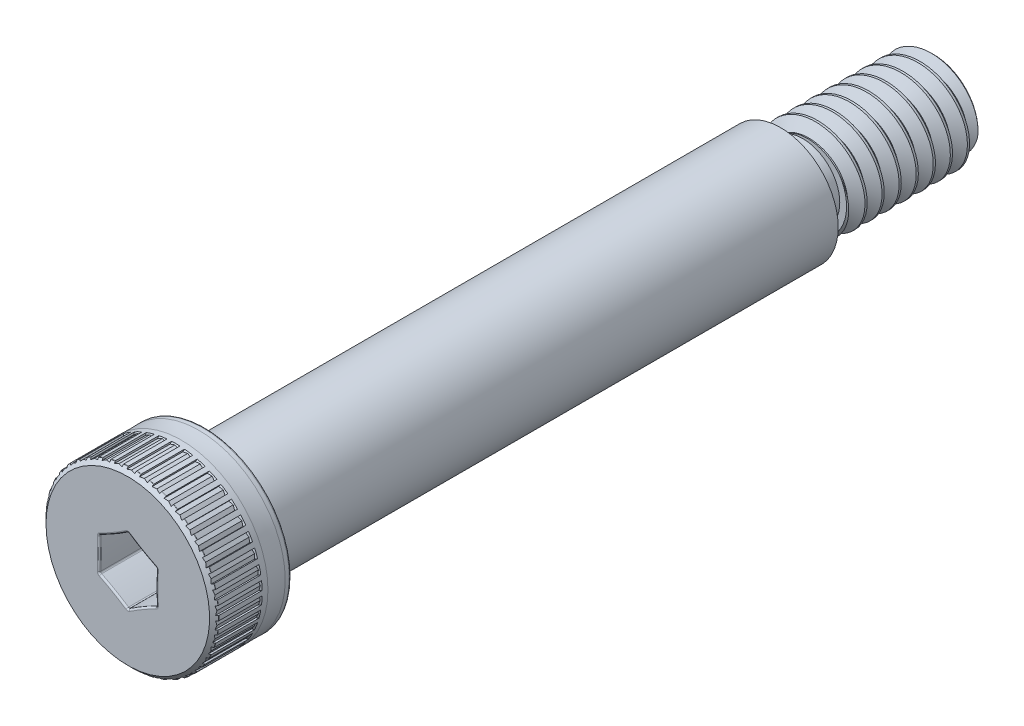
from build123d import *

# Parameters (mm, degrees)
SKETCH4_W             = 1.5875
SKETCH4_H             = 0.47625
SKETCH4_W_2           = 1.834444444
SKETCH4_H_2           = 0.916543552
CHAMFER1_SIZE         = 0.47625
FILLET1_R             = 0.28575
FILLET2_R             = 0.282222222
CHAMFER2_SIZE         = 0.352777778
CHAMFER3_SIZE         = 0.381
CUT_EXTRUDE1_DEPTH    = 3.9751
FILLET4_R             = 0.142875
DELETEFACE1_START     = -49.459444444
DELETEFACE1_OUTLINE_W = 10
DELETEFACE1_OUTLINE_H = 10
DELETEFACE1_OUTLINE_R = 3.058556448
DELETEFACE1_DEPTH     = 0.282222322
CUT_SWEEP1_PITCH      = 1.411111111
CUT_EXTRUDE2_REACH    = 69.436
CIRPATTERN1_COUNT     = 42
FILLET5_R             = 0.0508


# Read off the part's stored shape, not the designer's step: DeleteFace1, CirPattern2
with BuildPart() as part:
    # Sketch3 → Revolve1 (revolve)
    with BuildSketch(Plane(origin=(0, 0, 0), x_dir=(0, 0, -1), z_dir=(1, 0, 0)), mode=Mode.PRIVATE) as revolve1_sk:
        Polygon((-6.35, 7.14375), (0, 7.14375), (0, 4.7625), (47.625, 4.7625), (47.625, 3.9751), (60.325, 3.9751), (60.325, 0), (-6.35, 0), align=None)
    revolve(revolve1_sk.sketch.rotate(Axis((0, 0, 6.35), (0, 0, -1)), 90), axis=Axis((0, 0, 6.35), (0, 0, -1)))

    # Sketch4 → Cut-Revolve1 (revolve, cut)
    with BuildSketch(Plane(origin=(0, 0, 0), x_dir=(0, 0, -1), z_dir=(1, 0, 0)), mode=Mode.PRIVATE) as cut_revolve1_sk:
        with Locations((0.79375, 4.524375)):
            Rectangle(SKETCH4_W, SKETCH4_H)
        with Locations((48.542222222, 3.516828224)):
            Rectangle(SKETCH4_W_2, SKETCH4_H_2)
    revolve(cut_revolve1_sk.sketch.rotate(Axis((0, 0, 6.35), (0, 0, -1)), 90), axis=Axis((0, 0, 6.35), (0, 0, -1)), mode=Mode.SUBTRACT)

    # Chamfer1
    chamfer1_edges = [part.edges().sort_by_distance(p)[0] for p in [
        (-4.28625, 0, -1.5875),
    ]]
    chamfer(chamfer1_edges, length=CHAMFER1_SIZE - 0.0001)  # a hair under: the kernel refuses the full size

    # Fillet1
    fillet1_edges = [part.edges().sort_by_distance(p)[0] for p in [
        (-4.28625, 0, 0),
    ]]
    fillet(fillet1_edges, radius=FILLET1_R)

    # Fillet2
    fillet2_edges = [part.edges().sort_by_distance(p)[0] for p in [
        (-3.058556448, 0, -47.625),
        (-3.058556448, 0, -49.459444444),
    ]]
    fillet(fillet2_edges, radius=FILLET2_R)

    # Chamfer2
    chamfer2_edges = [part.edges().sort_by_distance(p)[0] for p in [
        (-3.9751, 0, -49.459444444),
        (-3.9751, 0, -60.325),
    ]]
    chamfer(chamfer2_edges, length=CHAMFER2_SIZE)

    # Chamfer3
    chamfer3_edges = [part.edges().sort_by_distance(p)[0] for p in [
        (-7.14375, 0, 6.35),
    ]]
    chamfer(chamfer3_edges, length=CHAMFER3_SIZE)

    # Sketch5 → Cut-Extrude1 (cut)
    with BuildSketch(Plane.XY.offset(6.35)):
        with BuildLine():
            ThreePointArc((2.38125, 1.374815329), (1.1668125, 2.020978533), (0, 2.749630657))
            ThreePointArc((0, 2.749630657), (-1.1668125, 2.020978533), (-2.38125, 1.374815329))
            ThreePointArc((-2.38125, 1.374815329), (-2.333625, 0), (-2.38125, -1.374815329))
            ThreePointArc((-2.38125, -1.374815329), (-1.1668125, -2.020978533), (0, -2.749630657))
            ThreePointArc((0, -2.749630657), (1.1668125, -2.020978533), (2.38125, -1.374815329))
            ThreePointArc((2.38125, -1.374815329), (2.333625, 0), (2.38125, 1.374815329))
        make_face()
    extrude(amount=-CUT_EXTRUDE1_DEPTH, mode=Mode.SUBTRACT)

    # Fillet4
    fillet4_edges = [part.edges().sort_by_distance(p)[0] for p in [
        (2.333625, 0, 2.3749),
        (2.38125, 1.374815329, 4.36245),
        (1.1668125, -2.020978533, 2.3749),
        (2.38125, -1.374815329, 4.36245),
        (-1.1668125, -2.020978533, 2.3749),
        (0, -2.749630657, 4.36245),
        (-2.333625, 0, 2.3749),
        (-2.38125, -1.374815329, 4.36245),
        (-1.1668125, 2.020978533, 2.3749),
        (-2.38125, 1.374815329, 4.36245),
        (1.1668125, 2.020978533, 2.3749),
        (0, 2.749630657, 4.36245),
        (2.333625, 0, 6.35),
        (1.1668125, 2.020978533, 6.35),
        (-1.1668125, 2.020978533, 6.35),
        (-2.333625, 0, 6.35),
        (-1.1668125, -2.020978533, 6.35),
        (1.1668125, -2.020978533, 6.35),
        (-7.14375, 0, 0),
    ]]
    fillet(fillet4_edges, radius=FILLET4_R)

    # DeleteFace1 outline → DeleteFace1 (cut)
    with BuildSketch(Plane.XY.offset(DELETEFACE1_START)):
        Rectangle(DELETEFACE1_OUTLINE_W, DELETEFACE1_OUTLINE_H)
        Circle(DELETEFACE1_OUTLINE_R, mode=Mode.SUBTRACT)
    extrude(amount=DELETEFACE1_DEPTH, mode=Mode.SUBTRACT)

    # Cut-Sweep1: the profile of Sketch7 profile screwed along a right-hand helix of 8.48 turns, 8 arcs to a turn; built about Z, then put on its axis
    cut_sweep1_z = Axis((0, 0, 0), (0, 0, 1))
    cut_sweep1_corners = [(4.051478629, 0, 0.044097222), (4.051478629, 0, -1.278819444), (3.058256448, 0, -0.70538235), (3.058256448, 0, -0.529339872)]
    with BuildLine(mode=Mode.PRIVATE) as cut_sweep1_profile:
        Line(cut_sweep1_corners[0], cut_sweep1_corners[1])
        Line(cut_sweep1_corners[1], cut_sweep1_corners[2])
        Line(cut_sweep1_corners[2], cut_sweep1_corners[3])
        Line(cut_sweep1_corners[3], cut_sweep1_corners[0])
    cut_sweep1_cap = Face(cut_sweep1_profile.wire())
    cut_sweep1_turn_angles = [0, 22.5, 45, 67.5, 90, 112.5, 135, 157.5, 180, 202.5, 225, 247.5, 270, 292.5, 315, 337.5, 360]
    cut_sweep1_turn_weights = [1, 0.9238795325112867, 1, 0.9238795325112867, 1, 0.9238795325112867, 1, 0.9238795325112867, 1, 0.9238795325112867, 1, 0.9238795325112867, 1, 0.9238795325112867, 1, 0.9238795325112867, 1]
    cut_sweep1_turn_rails = [Edge.make_bspline([Vector(p[0], p[1], 0).rotate(cut_sweep1_z, cut_sweep1_turn_angles[k]) / cut_sweep1_turn_weights[k] + Vector(0, 0, p[2] + CUT_SWEEP1_PITCH * cut_sweep1_turn_angles[k] / 360) for k in range(17)], [0, 0, 0, 1, 1, 2, 2, 3, 3, 4, 4, 5, 5, 6, 6, 7, 7, 8, 8, 8], 2, cut_sweep1_turn_weights) for p in cut_sweep1_corners]
    cut_sweep1_turn_sides = [Face.make_surface_from_curves(cut_sweep1_turn_rails[p[0]], cut_sweep1_turn_rails[p[1]]) for p in [(0, 1), (1, 2), (2, 3), (3, 0)]]
    cut_sweep1_last_angles = [2880, 2902.5, 2925, 2947.5, 2970, 2992.5, 3015, 3033.9, 3052.8]
    cut_sweep1_last_weights = [1, 0.9238795325112867, 1, 0.9238795325112867, 1, 0.9238795325112867, 1, 0.9460853588276014, 1]
    cut_sweep1_last_rails = [Edge.make_bspline([Vector(p[0], p[1], 0).rotate(cut_sweep1_z, cut_sweep1_last_angles[k]) / cut_sweep1_last_weights[k] + Vector(0, 0, p[2] + CUT_SWEEP1_PITCH * cut_sweep1_last_angles[k] / 360) for k in range(9)], [0, 0, 0, 1, 1, 2, 2, 3, 3, 4, 4, 4], 2, cut_sweep1_last_weights) for p in cut_sweep1_corners]
    cut_sweep1_last_sides = [Face.make_surface_from_curves(cut_sweep1_last_rails[p[0]], cut_sweep1_last_rails[p[1]]) for p in [(0, 1), (1, 2), (2, 3), (3, 0)]]
    cut_sweep1 = Plane(origin=(0, 0, -60.325), x_dir=(0, 1, 0), z_dir=(0, 0, 1)) * Solid(Shell([*[p.moved(Location((0, 0, CUT_SWEEP1_PITCH * i))) for i in range(8) for p in cut_sweep1_turn_sides], *cut_sweep1_last_sides, cut_sweep1_cap, cut_sweep1_cap.rotate(cut_sweep1_z, 3052.8).moved(Location((0, 0, CUT_SWEEP1_PITCH * 3052.8 / 360)))]))
    add(cut_sweep1, mode=Mode.SUBTRACT)

    # Cut-Extrude2: up to this plane
    cut_extrude2_end = Plane(origin=(0, 8.546915019, 0.978084981), z_dir=(0, 0.707106781186546, 0.7071067811865491))
    # Sketch8 → Cut-Extrude2 (cut, up to the surface)
    with BuildSketch(Plane.XY.offset(6.35), mode=Mode.PRIVATE) as cut_extrude2_sk1:
        Polygon((-0.3429, 7.14375), (0.3429, 7.14375), (0.328483903, 7.00659), (0, 7.07517), (-0.328483903, 7.00659), align=None)
    cut_extrude2_tool1 = split(extrude(cut_extrude2_sk1.sketch, amount=-CUT_EXTRUDE2_REACH, mode=Mode.PRIVATE), bisect_by=cut_extrude2_end, keep=Keep.BOTH, mode=Mode.PRIVATE)
    cut_extrude2 = cut_extrude2_tool1.solids().sort_by_distance((0, 7.090627, 6.35))[0]
    add(cut_extrude2, mode=Mode.SUBTRACT)

    # CirPattern1: Cut-Extrude2 ×42 about axis
    cirpattern1_axis = Axis((0, 0, 0), (0, 0, 1))
    for i in range(1, CIRPATTERN1_COUNT):
        add(cut_extrude2.rotate(cirpattern1_axis, i * 360 / CIRPATTERN1_COUNT), mode=Mode.SUBTRACT)

    # Fillet5
    fillet5_edges = [part.edges().sort_by_distance(p)[0] for p in [
        (0.533853106, 7.123774626, 5.969),
    ]]
    fillet(fillet5_edges, radius=FILLET5_R)

    # CirPattern2 outline → CirPattern2 (revolve, cut)
    with BuildSketch(Plane.XZ):
        with BuildLine():
            ThreePointArc((7.128871024, 5.983878976), (7.13988308, 5.96739827), (7.14375, 5.947957951))
            Line((7.14375, 5.947957951), (7.14375, 5.983878976))
            Line((7.14375, 5.983878976), (7.128871024, 5.983878976))
        make_face()
    revolve(axis=Axis((0, 0, 0), (0, 0, 1)), mode=Mode.SUBTRACT)

    # Sketch11 → Cut-Revolve6 (revolve, cut)
    with BuildSketch(Plane(origin=(0, 0, 0), x_dir=(0, 0, -1), z_dir=(1, 0, 0)), mode=Mode.PRIVATE) as cut_revolve6_sk:
        with BuildLine():
            Line((-1.905, 7.14375), (-0.47625, 7.14375))
            ThreePointArc((-0.47625, 7.14375), (-1.190625, 7.12597), (-1.905, 7.14375))
        make_face()
    revolve(cut_revolve6_sk.sketch.rotate(Axis((0, 0, 6.35), (0, 0, -1)), 90), axis=Axis((0, 0, 6.35), (0, 0, -1)), mode=Mode.SUBTRACT)


solid = part.part
